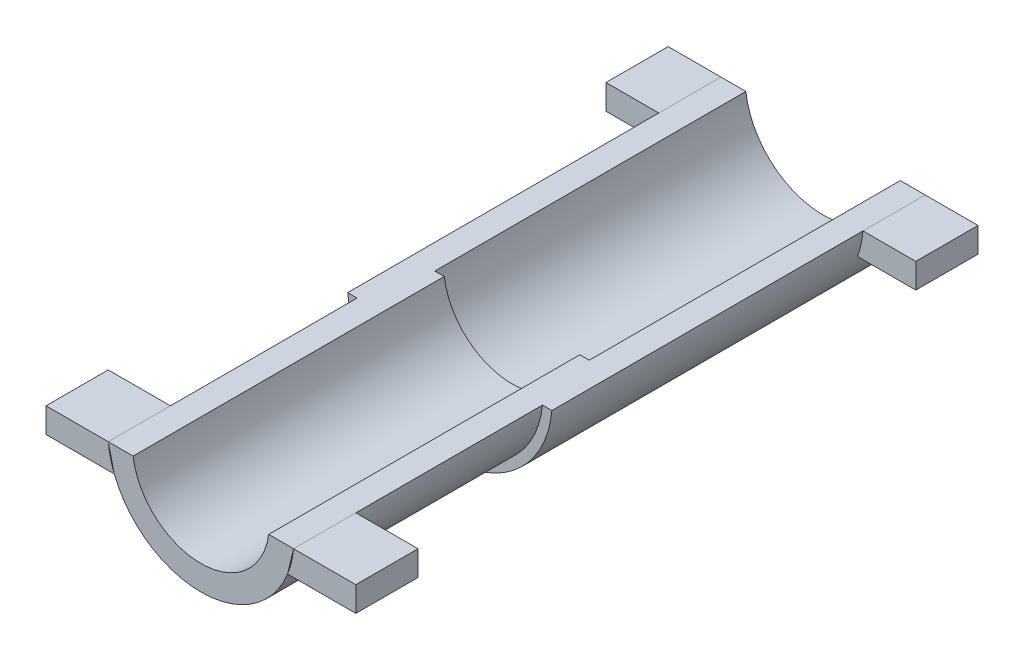
from build123d import *

# Parameters (mm, degrees)
BOSS_EXTRUDE1_DEPTH      = 40
BOSS_EXTRUDE2_DEPTH      = 10
BOSS_EXTRUDE3_DEPTH      = 10
BOSS_EXTRUDE3_DEPTH_BACK = 40
BOSS_EXTRUDE4_DEPTH      = 10


with BuildPart() as part:
    # Sketch1 → Boss-Extrude1 (new body)
    with BuildSketch(Plane.XY):
        with BuildLine():
            Line((-14.897247359, -1.5), (-10.897247359, -1.5))
            ThreePointArc((-10.897247359, -1.5), (0, -11), (10.897247359, -1.5))
            Line((10.897247359, -1.5), (14.897247359, -1.5))
            ThreePointArc((14.897247359, -1.5), (0, -14.972574223), (-14.897247359, -1.5))
        make_face()
    extrude(amount=BOSS_EXTRUDE1_DEPTH)

    # Sketch2 → Boss-Extrude2 (add)
    with BuildSketch(Plane.XY.offset(40)):
        with BuildLine():
            Line((13.925802629, -5.5), (14.897247359, -1.5))
            Line((14.897247359, -1.5), (10.897247359, -1.5))
            ThreePointArc((10.897247359, -1.5), (0, -11), (-10.897247359, -1.5))
            Line((-10.897247359, -1.5), (-14.897247359, -1.5))
            Line((-14.897247359, -1.5), (-13.925802629, -5.5))
            ThreePointArc((-13.925802629, -5.5), (0, -14.972574223), (13.925802629, -5.5))
        make_face()
        with BuildLine():
            Line((24.897247359, -1.5), (14.897247359, -1.5))
            ThreePointArc((14.897247359, -1.5), (14.54964098, -3.533543012), (13.925802629, -5.5))
            Line((13.925802629, -5.5), (24.897247359, -5.5))
            Line((24.897247359, -5.5), (24.897247359, -1.5))
        make_face()
        with BuildLine():
            Line((-24.897247359, -5.5), (-13.925802629, -5.5))
            ThreePointArc((-13.925802629, -5.5), (-14.54964098, -3.533543012), (-14.897247359, -1.5))
            Line((-14.897247359, -1.5), (-24.897247359, -1.5))
            Line((-24.897247359, -1.5), (-24.897247359, -5.5))
        make_face()
    extrude(amount=BOSS_EXTRUDE2_DEPTH)


with BuildPart() as boss_extrude2_piece_1:
    # of the separate pieces the step leaves, piece 1, a body of its own (boss_extrude2_pieces)
    add(part.part.solids().sort_by_distance((10.897247359, -1.5, 0))[0])

    # Sketch3 → Boss-Extrude3 (add, two sides: drawn at the far end of the back side and taken through both)
    with BuildSketch(Plane.XY.offset(-BOSS_EXTRUDE3_DEPTH_BACK)):
        with BuildLine():
            Line((-16.409673646, -1.5), (-12.409673646, -1.5))
            ThreePointArc((-12.409673646, -1.5), (0, -12.5), (12.409673646, -1.5))
            Line((12.409673646, -1.5), (16.409673646, -1.5))
            ThreePointArc((16.409673646, -1.5), (0, -16.478088153), (-16.409673646, -1.5))
        make_face()
    extrude(amount=BOSS_EXTRUDE3_DEPTH + BOSS_EXTRUDE3_DEPTH_BACK)

    # Sketch5 → Boss-Extrude4 (add)
    with BuildSketch(Plane(origin=(0, 0, -40), x_dir=(-1, 0, 0), z_dir=(0, 0, -1))):
        with BuildLine():
            ThreePointArc((-15.53310623, -5.5), (-16.096126756, -3.527335058), (-16.409673646, -1.5))
            Line((-16.409673646, -1.5), (-24.897247359, -1.5))
            Line((-24.897247359, -1.5), (-24.897247359, -5.5))
            Line((-24.897247359, -5.5), (-15.53310623, -5.5))
        make_face()
        with BuildLine():
            Line((-12.409673646, -1.5), (-16.409673646, -1.5))
            Line((-16.409673646, -1.5), (-15.53310623, -5.5))
            ThreePointArc((-15.53310623, -5.5), (0, -16.478088153), (15.53310623, -5.5))
            Line((15.53310623, -5.5), (16.409673646, -1.5))
            Line((16.409673646, -1.5), (12.409673646, -1.5))
            ThreePointArc((12.409673646, -1.5), (0, -12.5), (-12.409673646, -1.5))
        make_face()
        with BuildLine():
            ThreePointArc((16.409673646, -1.5), (16.096126756, -3.527335058), (15.53310623, -5.5))
            Line((15.53310623, -5.5), (24.897247359, -5.5))
            Line((24.897247359, -5.5), (24.897247359, -1.5))
            Line((24.897247359, -1.5), (16.409673646, -1.5))
        make_face()
    extrude(amount=BOSS_EXTRUDE4_DEPTH)


with BuildPart() as boss_extrude2_piece_2:
    # of the separate pieces the step leaves, piece 2, a body of its own (boss_extrude2_pieces)
    add(part.part.solids().sort_by_distance((-24.897247359, -1.5, 50))[0])


with BuildPart() as boss_extrude2_piece_3:
    # of the separate pieces the step leaves, piece 3, a body of its own (boss_extrude2_pieces)
    add(part.part.solids().sort_by_distance((24.897247359, -5.5, 50))[0])


with BuildPart() as boss_extrude4_piece_1:
    # of the separate pieces the step leaves, piece 1, a body of its own (boss_extrude4_pieces)
    add(boss_extrude2_piece_1.part.solids().sort_by_distance((10.897247359, -1.5, 0))[0])


with BuildPart() as boss_extrude4_piece_2:
    # of the separate pieces the step leaves, piece 2, a body of its own (boss_extrude4_pieces)
    add(boss_extrude2_piece_1.part.solids().sort_by_distance((24.897247359, -5.5, -50))[0])


with BuildPart() as boss_extrude4_piece_3:
    # of the separate pieces the step leaves, piece 3, a body of its own (boss_extrude4_pieces)
    add(boss_extrude2_piece_1.part.solids().sort_by_distance((-24.897247359, -5.5, -50))[0])


solid = Compound([boss_extrude2_piece_2.part, boss_extrude2_piece_3.part, boss_extrude4_piece_1.part, boss_extrude4_piece_2.part, boss_extrude4_piece_3.part])
